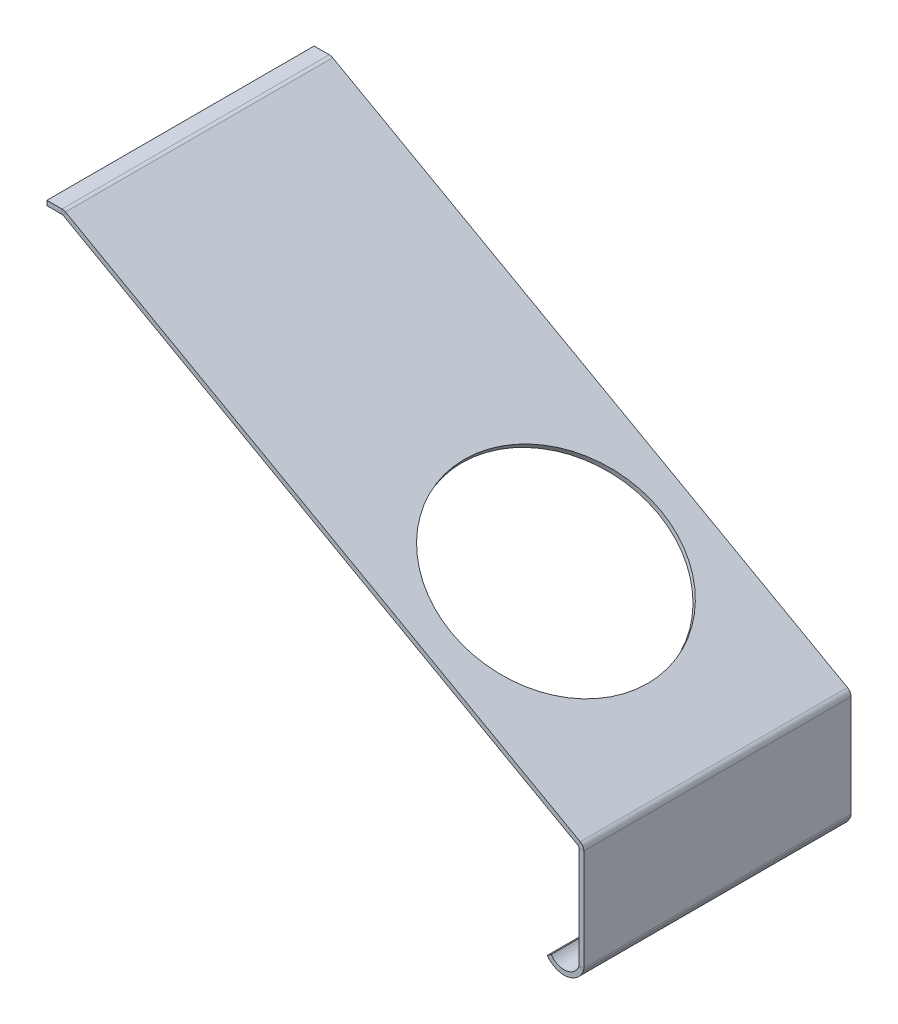
from build123d import *

# Parameters (mm, degrees)
BASE_FLANGE1_DEPTH = 85
SKETCH2_R          = 33.407017116
CUT_EXTRUDE1_DEPTH = 30


# Read off the part's stored shape, not the designer's step: Base-Flange1
with BuildPart() as part:
    # Base-Flange1 outline → Base-Flange1 (new body)
    with BuildSketch(Plane.XY):
        with BuildLine():
            ThreePointArc((4.779318239, -1.528186345), (4.767324577, -1.660569184), (4.731734161, -1.788640985))
            ThreePointArc((4.731734161, -1.788640985), (0.638889027, -5.018004141), (-4.132584418, -2.917240267))
            Line((-4.132584418, -2.917240267), (-5.358019189, -3.782289181))
            ThreePointArc((-5.358019189, -3.782289181), (0.828338715, -6.505992318), (6.134834735, -2.319026486))
            ThreePointArc((6.134834735, -2.319026486), (6.242900881, -1.930151397), (6.279318239, -1.528186345))
            Line((6.279318239, -1.528186345), (6.279318239, 30.807933335))
            ThreePointArc((6.279318239, 30.807933335), (5.972085307, 31.939269835), (5.134793267, 32.759791858))
            Line((5.134793267, 32.759791858), (-158.599410427, 124.369933097))
            ThreePointArc((-158.599410427, 124.369933097), (-159.127192628, 124.582318822), (-159.691485454, 124.654674574))
            Line((-159.691485454, 124.654674574), (-164.516949266, 124.654674574))
            Line((-164.516949266, 124.654674574), (-164.516949266, 123.154674574))
            Line((-164.516949266, 123.154674574), (-159.691485454, 123.154674574))
            ThreePointArc((-159.691485454, 123.154674574), (-159.50564172, 123.13084499), (-159.331822365, 123.060898051))
            Line((-159.331822365, 123.060898051), (4.402381329, 31.450756812))
            ThreePointArc((4.402381329, 31.450756812), (4.678134399, 31.180526765), (4.779318239, 30.807933335))
            Line((4.779318239, 30.807933335), (4.779318239, -1.528186345))
        make_face()
    extrude(amount=BASE_FLANGE1_DEPTH)

    # Sketch2 → Cut-Extrude1 (cut)
    with BuildSketch(Plane(origin=(15.183550365, 27.137459833, 0), x_dir=(0.872690030929894, -0.48827462550861755, 0), z_dir=(0.48827462550861755, 0.872690030929894, 0))):
        with Locations(Location((-69.081583233, -42.5, 0), (0, 0, 180))):
            Circle(SKETCH2_R)
    extrude(amount=-CUT_EXTRUDE1_DEPTH, mode=Mode.SUBTRACT)


solid = part.part
